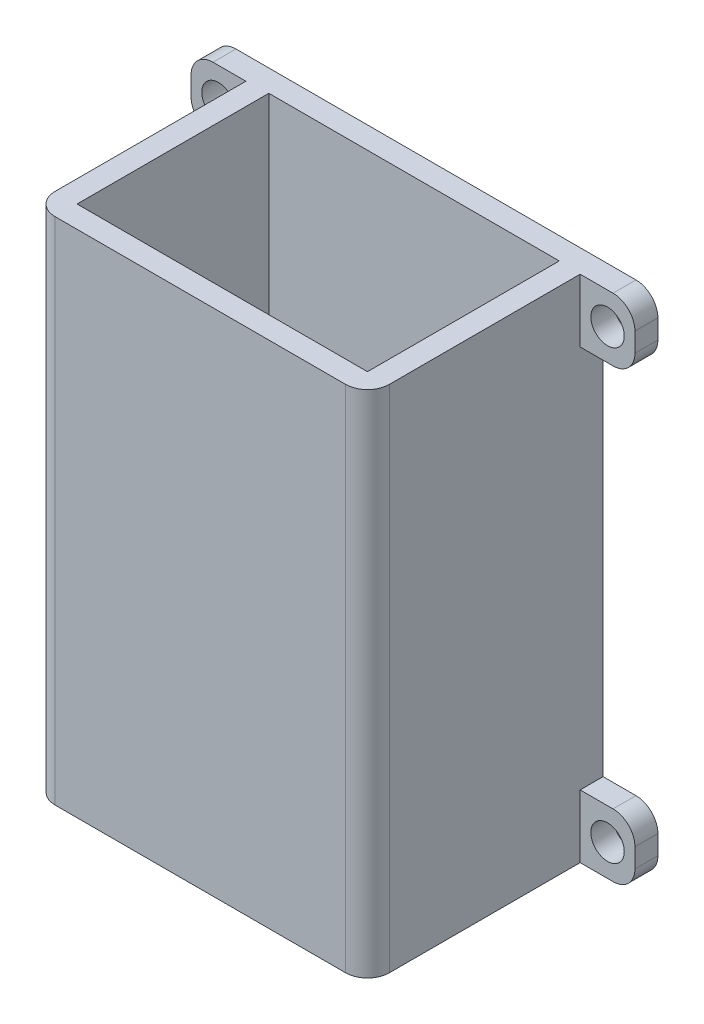
from build123d import *

# Parameters (mm, degrees)
SKETCH1_W               = 30.5
SKETCH1_H               = 21.5
SKETCH1_W_2             = 26.5
SKETCH1_H_2             = 17.5
BOSS_EXTRUDE1_DEPTH     = 46.5
FILLET1_R               = 2
SKETCH2_W               = 2.094102849
SKETCH2_H               = 5.748513101
BOSS_EXTRUDE2_DEPTH     = 5
SKETCH3_R               = 1.525
CUT_EXTRUDE1_DEPTH      = 55.303787568
MIRROR4_COPY_1_SKETCH_W = 2.094102849
MIRROR4_COPY_1_SKETCH_H = 5.748513101
MIRROR4_COPY_1_DEPTH    = 5
MIRROR4_COPY_2_SKETCH_R = 1.525
MIRROR4_COPY_2_DEPTH    = 55.303787568
MIRROR4_COPY_3_SKETCH_W = 2.094102849
MIRROR4_COPY_3_SKETCH_H = 5.748513101
MIRROR4_COPY_3_DEPTH    = 5
MIRROR4_COPY_4_SKETCH_R = 1.525
MIRROR4_COPY_4_DEPTH    = 55.303787568
FILLET2_R               = 2


with BuildPart() as part:
    # Sketch1 → Boss-Extrude1 (new body)
    with BuildSketch(Plane(origin=(0, 0, 0), x_dir=(1, 0, 0), z_dir=(0, 1, 0))):
        Rectangle(SKETCH1_W, SKETCH1_H)
        Rectangle(SKETCH1_W_2, SKETCH1_H_2, mode=Mode.SUBTRACT)
    extrude(amount=BOSS_EXTRUDE1_DEPTH)

    # Fillet1
    fillet1_edges = [part.edges().sort_by_distance(p)[0] for p in [
        (-15.25, 23.25, 10.75),
        (15.25, 23.25, 10.75),
    ]]
    fillet(fillet1_edges, radius=FILLET1_R)

    # Sketch2 → Boss-Extrude2 (add)
    with BuildSketch(Plane.ZY.offset(15.25)):
        with Locations((-9.702948576, 2.874256551)):
            Rectangle(SKETCH2_W, SKETCH2_H)
    boss_extrude2 = extrude(amount=BOSS_EXTRUDE2_DEPTH)

    # Sketch3 → Cut-Extrude1 (cut, symmetric)
    with BuildSketch(Plane.XY.offset(-8.655897151)):
        with Locations((-17.75, 2.874256551)):
            Circle(SKETCH3_R)
    cut_extrude1 = extrude(amount=CUT_EXTRUDE1_DEPTH, both=True, mode=Mode.SUBTRACT)

    # Mirror3: Boss-Extrude2, Cut-Extrude1 across plane
    add(boss_extrude2.mirror(Plane.ZX.offset(23.25)))
    add(cut_extrude1.mirror(Plane.ZX.offset(23.25)), mode=Mode.SUBTRACT)

    # Mirror4 copy 1 sketch → Mirror4 copy 1 (add)
    with BuildSketch(Plane(origin=(15.25, 46.5, 0), x_dir=(0, 0, 1), z_dir=(1, 0, 0))):
        with Locations((-9.702948576, 2.874256551)):
            Rectangle(MIRROR4_COPY_1_SKETCH_W, MIRROR4_COPY_1_SKETCH_H)
    extrude(amount=MIRROR4_COPY_1_DEPTH)

    # Mirror4 copy 2 sketch → Mirror4 copy 2 (cut, symmetric)
    with BuildSketch(Plane(origin=(0, 46.5, -8.655897151), x_dir=(-1, 0, 0), z_dir=(0, 0, 1))):
        with Locations((-17.75, 2.874256551)):
            Circle(MIRROR4_COPY_2_SKETCH_R)
    extrude(amount=MIRROR4_COPY_2_DEPTH, both=True, mode=Mode.SUBTRACT)

    # Mirror4 copy 3 sketch → Mirror4 copy 3 (add)
    with BuildSketch(Plane(origin=(15.25, 0, 0), x_dir=(0, 0, 1), z_dir=(1, 0, 0))):
        with Locations((-9.702948576, -2.874256551)):
            Rectangle(MIRROR4_COPY_3_SKETCH_W, MIRROR4_COPY_3_SKETCH_H)
    extrude(amount=MIRROR4_COPY_3_DEPTH)

    # Mirror4 copy 4 sketch → Mirror4 copy 4 (cut, symmetric)
    with BuildSketch(Plane(origin=(0, 0, -8.655897151), x_dir=(-1, 0, 0), z_dir=(0, 0, 1))):
        with Locations((-17.75, -2.874256551)):
            Circle(MIRROR4_COPY_4_SKETCH_R)
    extrude(amount=MIRROR4_COPY_4_DEPTH, both=True, mode=Mode.SUBTRACT)

    # Fillet2
    fillet2_edges = [part.edges().sort_by_distance(p)[0] for p in [
        (20.25, 46.5, -9.702948576),
        (20.25, 40.751486899, -9.702948576),
        (20.25, 0, -9.702948576),
        (20.25, 5.748513101, -9.702948576),
        (-20.25, 5.748513101, -9.702948576),
        (-20.25, 0, -9.702948576),
        (-20.25, 40.751486899, -9.702948576),
        (-20.25, 46.5, -9.702948576),
    ]]
    fillet(fillet2_edges, radius=FILLET2_R)


solid = part.part
